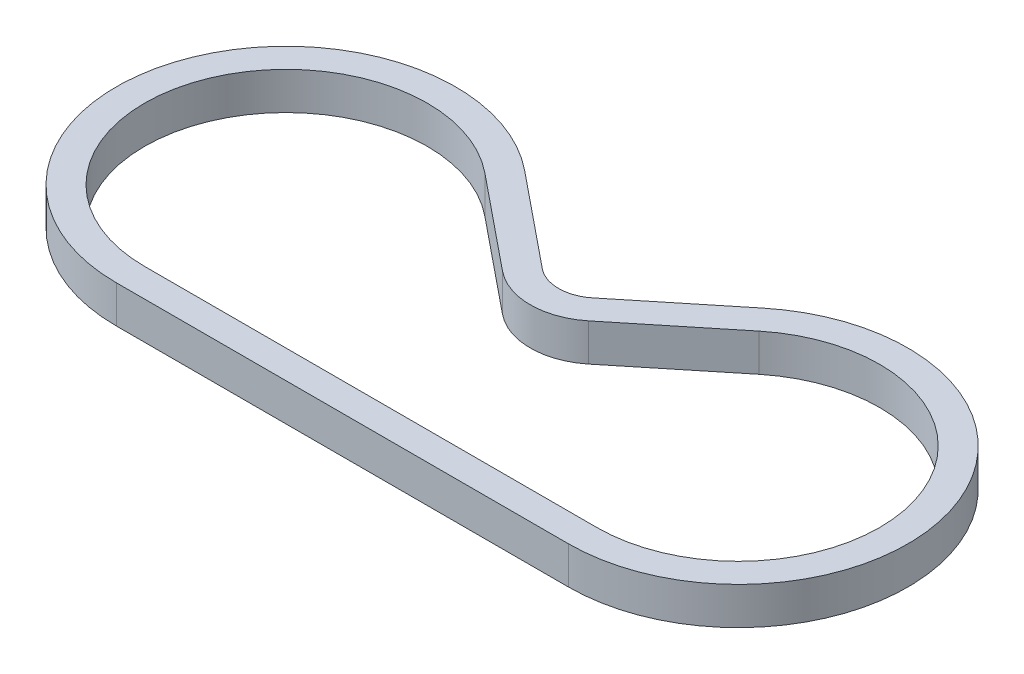
from build123d import *

# Parameters (mm, degrees)
BOSS_EXTRUDE1_DEPTH = 7.7978


with BuildPart() as part:
    # Sketch1 → Boss-Extrude1 (new body)
    with BuildSketch(Plane(origin=(0, 0, 0), x_dir=(1, 0, 0), z_dir=(0, 1, 0))):
        with BuildLine():
            ThreePointArc((-47.099999988, 35.3387), (-82.4387, 6e-09), (-47.1, -35.3387))
            Line((-47.1, -35.3387), (47.1, -35.3387))
            ThreePointArc((47.1, -35.3387), (82.4387, 0), (47.1, 35.3387))
            ThreePointArc((47.1, 35.3387), (35.282438586, 33.304188324), (24.825593139, 27.434914191))
            Line((24.825593139, 27.434914191), (5.246181367, 11.538389753))
            ThreePointArc((5.246181367, 11.538389753), (0, 9.67685), (-5.246181367, 11.538389753))
            Line((-5.246181367, 11.538389753), (-24.825593139, 27.434914191))
            ThreePointArc((-24.825593139, 27.434914191), (-35.282438586, 33.304188324), (-47.1, 35.3387))
        make_face()
        with BuildLine():
            Line((47.1, -29.4459), (-47.1, -29.4459))
            ThreePointArc((-47.1, -29.4459), (-76.5459, 6e-09), (-47.099999988, 29.4459))
            ThreePointArc((-47.1, 29.4459), (-37.253040954, 27.750647278), (-28.539895724, 22.860086528))
            Line((-28.539895724, 22.860086528), (-8.960483951, 6.963562089))
            ThreePointArc((-8.960483951, 6.963562089), (0, 3.78405), (8.960483951, 6.963562089))
            Line((8.960483951, 6.963562089), (28.539895724, 22.860086528))
            ThreePointArc((28.539895724, 22.860086528), (37.253040953, 27.750647278), (47.099999999, 29.4459))
            ThreePointArc((47.099999999, 29.4459), (76.5459, 0), (47.1, -29.4459))
        make_face(mode=Mode.SUBTRACT)
    extrude(amount=BOSS_EXTRUDE1_DEPTH)


solid = part.part
